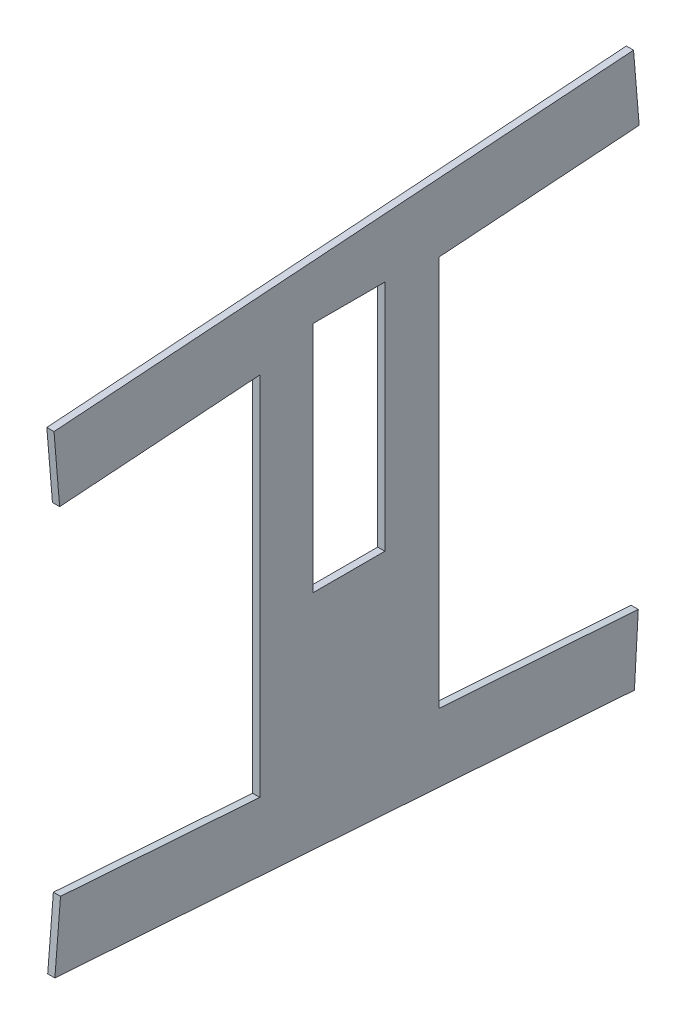
from build123d import *

# Parameters (mm, degrees)
BOSS_EXTRUDE1_DEPTH = 2
SKETCH2_W           = 20
SKETCH2_H           = 65
CUT_EXTRUDE1_DEPTH  = 114.018546023


with BuildPart() as part:
    # Sketch1 → Boss-Extrude1 (new body)
    with BuildSketch(Plane(origin=(0, 0, 0), x_dir=(0, 0, -1), z_dir=(1, 0, 0))):
        Polygon((-23.426509252, -51), (-23.426509252, 51), (-79.229197324, 47.097895925), (-80.802688071, 66.034262797), (80.802688071, 77.334811544), (82.376178819, 58.398444672), (26.573490748, 54.496340597), (26.573490748, -54.496340597), (82.128061072, -58.381094589), (81.050805817, -77.352161627), (-80.554570325, -66.05161288), (-78.981079577, -47.115246008), align=None)
    extrude(amount=BOSS_EXTRUDE1_DEPTH)

    # Sketch2 → Cut-Extrude1 (cut, through all)
    with BuildSketch(Plane(origin=(2, 0, 0), x_dir=(0, 0, -1), z_dir=(1, 0, 0))):
        with Locations((1.46172303, 23.500819189)):
            Rectangle(SKETCH2_W, SKETCH2_H)
    extrude(amount=-CUT_EXTRUDE1_DEPTH, mode=Mode.SUBTRACT)


solid = part.part
